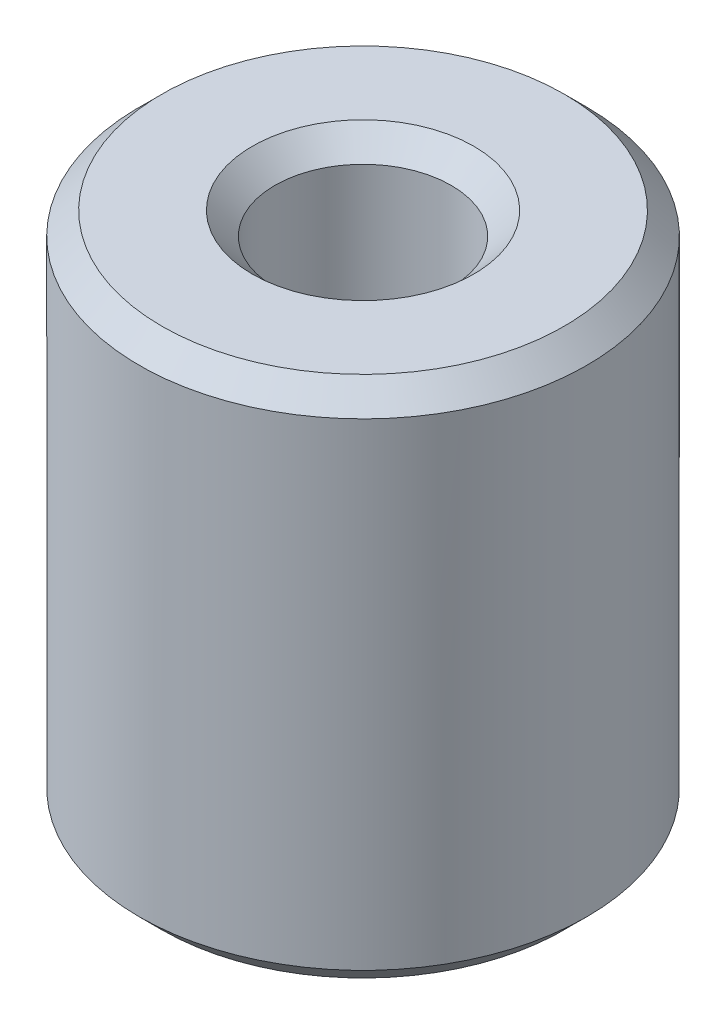
from build123d import *

# Parameters (mm, degrees)
SKETCH1_R           = 37.5
BOSS_EXTRUDE1_DEPTH = 87.634457171
SKETCH2_R           = 14.785190164
CUT_EXTRUDE1_DEPTH  = 103.431919261
CHAMFER1_SIZE       = 3.785108644


with BuildPart() as part:
    # Sketch1 → Boss-Extrude1 (new body)
    with BuildSketch(Plane(origin=(0, 0, 0), x_dir=(1, 0, 0), z_dir=(0, 1, 0))):
        Circle(SKETCH1_R)
    extrude(amount=BOSS_EXTRUDE1_DEPTH)

    # Sketch2 → Cut-Extrude1 (cut, through all)
    with BuildSketch(Plane(origin=(0, 0, 0), x_dir=(1, 0, 0), z_dir=(0, 1, 0))):
        Circle(SKETCH2_R)
    extrude(amount=CUT_EXTRUDE1_DEPTH, mode=Mode.SUBTRACT)

    # Chamfer1
    chamfer1_edges = [part.edges().sort_by_distance(p)[0] for p in [
        (-14.785190164, 87.634457171, 0),
        (-14.785190164, 0, 0),
        (-37.5, 0, 0),
        (-37.5, 87.634457171, 0),
    ]]
    chamfer(chamfer1_edges, length=CHAMFER1_SIZE)


solid = part.part
